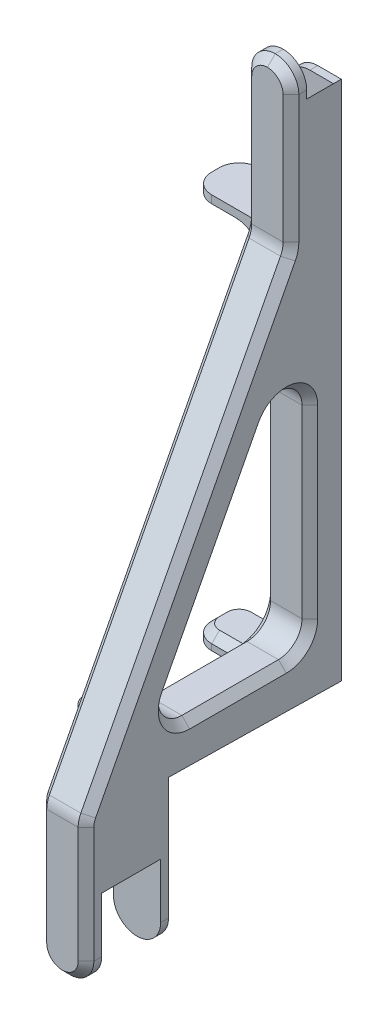
from build123d import *

# Parameters (mm, degrees)
BOSS_EXTRUDE1_DEPTH = 7.62
FILLET1_R           = 7.62
SKETCH2_W           = 8.636
SKETCH2_H           = 40.64
BOSS_EXTRUDE2_DEPTH = 2.54
SKETCH3_W           = 20.32
SKETCH3_H           = 3.81
SKETCH3_H_2         = 5.08
BOSS_EXTRUDE3_DEPTH = 15.24
SKETCH6_W           = 20.32
SKETCH6_H           = 15.24
BOSS_EXTRUDE5_DEPTH = 3.81
FILLET2_R           = 6.35
BOSS_EXTRUDE4_DEPTH = 50.8
CUT_EXTRUDE1_DEPTH  = 50.8
CHAMFER1_SIZE       = 2.54


# Some blends are built 0.0001 mm under size
with BuildPart() as part:
    # Sketch1 → Boss-Extrude1 (new, symmetric)
    with BuildSketch(Plane(origin=(0, 0, 0), x_dir=(0, 0, -1), z_dir=(1, 0, 0))):
        Polygon((-5.08, -40.64), (-13.716, -40.64), (-13.716, 10.16), (-18.796, 10.16), (-18.796, -40.64), (-85.09, -167.64), (-85.09, -214.63), (-80.01, -214.63), (-80.01, -189.23), (-60.96, -189.23), (-60.96, -214.63), (-55.88, -214.63), (-55.88, -167.64), (0, -167.64), (0, 0), (-5.08, 0), align=None)
        Polygon((-64.134437068, -154.94), (-12.7, -56.406595656), (-12.7, -154.94), align=None, mode=Mode.SUBTRACT)
    extrude(amount=BOSS_EXTRUDE1_DEPTH, both=True)

    # Fillet1
    fillet1_edges = [part.edges().sort_by_distance(p)[0] for p in [
        (0, -167.64, 85.09),
        (0, -56.406595656, 12.7),
        (0, -154.94, 12.7),
        (0, -40.64, 18.796),
        (0, -154.94, 64.134437068),
        (-7.62, 0, 2.54),
        (-7.62, 10.16, 16.256),
        (7.62, 10.16, 16.256),
        (-7.62, -214.63, 58.42),
        (7.62, -214.63, 58.42),
        (7.62, -214.63, 82.55),
        (-7.62, -214.63, 82.55),
    ]]
    fillet(fillet1_edges, radius=FILLET1_R - 0.0001)  # a hair under: the kernel refuses the full size

    # Sketch2 → Boss-Extrude2 (add)
    with BuildSketch(Plane(origin=(7.62, 0, 0), x_dir=(0, 0, -1), z_dir=(1, 0, 0))):
        with Locations((-9.398, -20.32)):
            Rectangle(SKETCH2_W, SKETCH2_H)
    extrude(amount=-BOSS_EXTRUDE2_DEPTH)

    # Sketch3 → Boss-Extrude3 (add)
    with BuildSketch(Plane(origin=(0, 0, 0), x_dir=(-1, 0, 0), z_dir=(0, 0, -1))):
        with Locations((17.78, -165.735)):
            Rectangle(SKETCH3_W, SKETCH3_H)
        with Locations((17.78, -43.18)):
            Rectangle(SKETCH3_W, SKETCH3_H_2)
    extrude(amount=-BOSS_EXTRUDE3_DEPTH)

    # Sketch6 → Boss-Extrude5 (add)
    with BuildSketch(Plane(origin=(0, -167.64, 0), x_dir=(-1, 0, 0), z_dir=(0, -1, 0))):
        with Locations((17.78, -48.26)):
            Rectangle(SKETCH6_W, SKETCH6_H)
    extrude(amount=-BOSS_EXTRUDE5_DEPTH)

    # Fillet2
    fillet2_edges = [part.edges().sort_by_distance(p)[0] for p in [
        (-7.62, -163.83, 7.62),
        (-27.94, -165.735, 15.24),
        (-27.94, -165.735, 0),
        (-7.62, -45.72, 7.62),
        (-27.94, -43.18, 15.24),
        (-27.94, -43.18, 0),
        (-27.94, -165.735, 55.88),
        (-27.94, -165.735, 40.64),
        (-7.62, -163.83, 48.26),
    ]]
    fillet(fillet2_edges, radius=FILLET2_R)

    # Sketch4 → Boss-Extrude4 (add)
    with BuildSketch(Plane(origin=(7.62, 0, 0), x_dir=(0, 0, -1), z_dir=(1, 0, 0))):
        Polygon((-55.88, -167.64), (0, -168.615389028), (0, -167.64), align=None)
    extrude(amount=-BOSS_EXTRUDE4_DEPTH)

    # Sketch5 → Cut-Extrude1 (cut)
    with BuildSketch(Plane(origin=(0, -167.64, 0), x_dir=(1, 0, 0), z_dir=(0, 1, 0))):
        with BuildLine():
            Line((-7.62, -40.64), (-7.62, -15.24))
            Line((-7.62, -15.24), (-21.59, -15.24))
            ThreePointArc((-21.59, -15.24), (-26.080128061, -13.380128061), (-27.94, -8.89))
            Line((-27.94, -8.89), (-27.94, -6.35))
            ThreePointArc((-27.94, -6.35), (-26.080128061, -1.859871939), (-21.59, 0))
            Line((-21.59, 0), (-43.18, 0))
            Line((-43.18, 0), (-43.18, -55.88))
            Line((-43.18, -55.88), (-21.59, -55.88))
            ThreePointArc((-21.59, -55.88), (-26.080128061, -54.020128061), (-27.94, -49.53))
            Line((-27.94, -49.53), (-27.94, -46.99))
            ThreePointArc((-27.94, -46.99), (-26.080128061, -42.499871939), (-21.59, -40.64))
            Line((-21.59, -40.64), (-7.62, -40.64))
        make_face()
    extrude(amount=-CUT_EXTRUDE1_DEPTH, mode=Mode.SUBTRACT)

    # Chamfer1
    # the kernel refuses this chamfer: 2.54 mm, written as the material it takes off along each edge
    with BuildSketch(Plane(origin=(-13.97, -157.48, 15.24), x_dir=(0.5156018398614169, 0.8568283041143783, 0), z_dir=(-0.8568283041143783, 0.5156018398614169, 0))) as chamfer1_piece_1_section:
        Polygon((6.35, CHAMFER1_SIZE), (6.35 + CHAMFER1_SIZE, 0), (6.35, 0), align=None)
    chamfer1_piece_1 = revolve(axis=Axis((-13.97, -157.48, 15.24), (0, 0, -1)), revolution_arc=148.962308712, mode=Mode.PRIVATE)
    chamfer1_piece_1 = split(chamfer1_piece_1, bisect_by=Plane(origin=(-7.62, -162.229769577, 14.262585921), z_dir=(-1, 0, 0)), keep=Keep.TOP, mode=Mode.PRIVATE)
    add(chamfer1_piece_1, mode=Mode.SUBTRACT)
    with BuildSketch(Plane(origin=(-21.59, -163.83, 15.24), x_dir=(0, 0.027495876610589984, -0.9996219169112966), z_dir=(1, 0, 0)), Plane(origin=(-21.59, -45.72, 0), x_dir=(0, -0.027495876610587288, 0.9996219169112968), z_dir=(1, 0, 0)), Plane(origin=(-21.59, -163.83, 55.88), x_dir=(0, 0.027495876610589984, -0.9996219169112966), z_dir=(1, 0, 0)), Plane(origin=(-13.97, -163.83, 40.64), x_dir=(0, 0.027495876610589984, 0.9996219169112966), z_dir=(-1, 0, 0))) as chamfer1_piece_2:
        Polygon((CHAMFER1_SIZE * 0.999621916911, -CHAMFER1_SIZE * 0.0274958766106), (-CHAMFER1_SIZE * 0.0274958766106, -CHAMFER1_SIZE * 0.999621916911), (0, 0), align=None)
    extrude(amount=7.62, mode=Mode.SUBTRACT)
    with BuildSketch(Plane(origin=(-21.59, -163.83, 8.89), x_dir=(-1, 0, 0), z_dir=(0, 0, -1))) as chamfer1_piece_3:
        Polygon((6.35 - CHAMFER1_SIZE, 0), (6.35, -CHAMFER1_SIZE), (6.35, 0), align=None)
    revolve(axis=Axis((-21.59, -163.83, 8.89), (0, 1, 0)), revolution_arc=90, mode=Mode.SUBTRACT)
    with BuildSketch(Plane(origin=(-21.59, -163.83, 6.35), x_dir=(0, 0, -1), z_dir=(1, 0, 0))) as chamfer1_piece_4:
        Polygon((6.35 - CHAMFER1_SIZE, 0), (6.35, -CHAMFER1_SIZE), (6.35, 0), align=None)
    revolve(axis=Axis((-21.59, -163.83, 6.35), (0, 1, 0)), revolution_arc=90, mode=Mode.SUBTRACT)
    with BuildSketch(Plane(origin=(-21.59, -163.83, 0), x_dir=(0, 0.027495876610590005, 0.9996219169112966), z_dir=(1, 0, 0)), Plane(origin=(-21.59, -45.72, 15.24), x_dir=(0, -0.027495876610587267, -0.9996219169112966), z_dir=(1, 0, 0))) as chamfer1_piece_5:
        Polygon((CHAMFER1_SIZE * 0.999621916911, CHAMFER1_SIZE * 0.0274958766106), (-CHAMFER1_SIZE * 0.0274958766106, CHAMFER1_SIZE * 0.999621916911), (0, 0), align=None)
    extrude(amount=7.62, mode=Mode.SUBTRACT)
    with BuildSketch(Plane(origin=(14.152074789, 0, 0), x_dir=(0, 0.027495876610586334, 0.9996219169112968), z_dir=(-1, 0, 0))) as chamfer1_piece_6:
        Polygon((CHAMFER1_SIZE * 0.999621916911, -CHAMFER1_SIZE * 0.0274958766106), (-CHAMFER1_SIZE * 0.0274958766106, -CHAMFER1_SIZE * 0.999621916911), (0, 0), align=None)
    extrude(amount=14.152174789, mode=Mode.SUBTRACT)
    with BuildSketch(Plane(origin=(-13.97, -157.48, 0), x_dir=(1, 0, 0), z_dir=(0, 1, 0))) as chamfer1_piece_7:
        Polygon((6.35, -CHAMFER1_SIZE), (6.35 + CHAMFER1_SIZE, 0), (6.35, 0), align=None)
    revolve(axis=Axis((-13.97, -157.48, 0), (0, 0, -1)), revolution_arc=90, mode=Mode.SUBTRACT)
    with BuildSketch(Plane(origin=(-0.0001, -7.6199, 0), x_dir=(0, 1, 0), z_dir=(1, 0, 0))) as chamfer1_piece_8:
        Polygon((7.6199, CHAMFER1_SIZE), (7.6199 - CHAMFER1_SIZE, 0), (7.6199, 0), align=None)
    revolve(axis=Axis((-0.0001, -7.6199, 0), (0, 0, 1)), revolution_arc=90, mode=Mode.SUBTRACT)
    with BuildSketch(Plane(origin=(-7.62, -157.48, 0), x_dir=(-0.027495876610586275, 0, 0.9996219169112968), z_dir=(0, 1, 0))) as chamfer1_piece_9:
        Polygon((CHAMFER1_SIZE * 0.999621916911, CHAMFER1_SIZE * 0.0274958766106), (-CHAMFER1_SIZE * 0.0274958766106, CHAMFER1_SIZE * 0.999621916911), (0, 0), align=None)
    extrude(amount=105.41, mode=Mode.SUBTRACT)
    with BuildSketch(Plane(origin=(-7.62, -40.64, 0), x_dir=(-0.027495876610586275, 0, 0.9996219169112968), z_dir=(0, 1, 0))) as chamfer1_piece_10:
        Polygon((CHAMFER1_SIZE * 0.999621916911, CHAMFER1_SIZE * 0.0274958766106), (-CHAMFER1_SIZE * 0.0274958766106, CHAMFER1_SIZE * 0.999621916911), (0, 0), align=None)
    extrude(amount=33.0201, mode=Mode.SUBTRACT)
    with BuildSketch(Plane(origin=(7.62, 6.532074789, 0), x_dir=(0.027495876610586275, 0, 0.9996219169112968), z_dir=(0, -1, 0))) as chamfer1_piece_11:
        Polygon((CHAMFER1_SIZE * 0.999621916911, CHAMFER1_SIZE * 0.0274958766106), (-CHAMFER1_SIZE * 0.0274958766106, CHAMFER1_SIZE * 0.999621916911), (0, 0), align=None)
    extrude(amount=181.679538607, mode=Mode.SUBTRACT)
    with BuildSketch(Plane(origin=(7.62, -169.509128266, 85.09), x_dir=(0.02749587661058625, 0, -0.9996219169112968), z_dir=(0, -1, 0))) as chamfer1_piece_12:
        Polygon((CHAMFER1_SIZE * 0.999621916911, -CHAMFER1_SIZE * 0.0274958766106), (-CHAMFER1_SIZE * 0.0274958766106, -CHAMFER1_SIZE * 0.999621916911), (0, 0), align=None)
    extrude(amount=37.500971734, mode=Mode.SUBTRACT)
    with BuildSketch(Plane(origin=(7.62, -169.509128266, 77.4701), x_dir=(0, 0, 1), z_dir=(0, -1, 0))) as chamfer1_piece_13:
        Polygon((7.6199 - CHAMFER1_SIZE, 0), (7.6199, CHAMFER1_SIZE), (7.6199, 0), align=None)
    revolve(axis=Axis((7.62, -169.509128266, 77.4701), (-1, 0, 0)), revolution_arc=27.564558934, mode=Mode.SUBTRACT)
    with BuildSketch(Plane(origin=(7.62, -42.296963493, 19.660934944), x_dir=(0.027495876610586296, -0.46257281641520054, -0.8861548207187752), z_dir=(0, -0.8864899875913883, 0.4627477735227046))) as chamfer1_piece_14:
        Polygon((CHAMFER1_SIZE * 0.999621916911, -CHAMFER1_SIZE * 0.0274958766106), (-CHAMFER1_SIZE * 0.0274958766106, -CHAMFER1_SIZE * 0.999621916911), (0, 0), align=None)
    extrude(amount=139.52337279, mode=Mode.SUBTRACT)
    with BuildSketch(Plane(origin=(7.62, -38.770871734, 26.4159), x_dir=(0, -0.4627477735227039, -0.8864899875913886), z_dir=(0, -0.8864899875913886, 0.4627477735227039))) as chamfer1_piece_15:
        Polygon((7.6199 + CHAMFER1_SIZE, 0), (7.6199, -CHAMFER1_SIZE), (7.6199, 0), align=None)
    revolve(axis=Axis((7.62, -38.770871734, 26.4159), (1, 0, 0)), revolution_arc=27.564558934, mode=Mode.SUBTRACT)
    with BuildSketch(Plane(origin=(7.62, 2.5401, 18.796), x_dir=(0.02749587661058629, 0, -0.9996219169112968), z_dir=(0, -1, 0))) as chamfer1_piece_16:
        Polygon((CHAMFER1_SIZE * 0.999621916911, -CHAMFER1_SIZE * 0.0274958766106), (-CHAMFER1_SIZE * 0.0274958766106, -CHAMFER1_SIZE * 0.999621916911), (0, 0), align=None)
    extrude(amount=41.310971734, mode=Mode.SUBTRACT)
    with BuildSketch(Plane(origin=(0.0001, 2.5401, 18.796), x_dir=(0, 1, 0), z_dir=(-1, 0, 0))) as chamfer1_piece_17:
        Polygon((7.6199, CHAMFER1_SIZE), (7.6199 - CHAMFER1_SIZE, 0), (7.6199, 0), align=None)
    revolve(axis=Axis((0.0001, 2.5401, 18.796), (0, 0, -1)), revolution_arc=90, mode=Mode.SUBTRACT)
    with BuildSketch(Plane(origin=(-0.0001, 2.5401, 18.796), x_dir=(0, 1, 0), z_dir=(1, 0, 0))) as chamfer1_piece_18:
        Polygon((7.6199 - CHAMFER1_SIZE, 0), (7.6199, -CHAMFER1_SIZE), (7.6199, 0), align=None)
    revolve(axis=Axis((-0.0001, 2.5401, 18.796), (0, 0, 1)), revolution_arc=90, mode=Mode.SUBTRACT)
    with BuildSketch(Plane(origin=(-7.62, 2.5401, 18.796), x_dir=(-0.02749587661058629, 0, -0.9996219169112968), z_dir=(0, -1, 0))) as chamfer1_piece_19:
        Polygon((CHAMFER1_SIZE * 0.999621916911, CHAMFER1_SIZE * 0.0274958766106), (-CHAMFER1_SIZE * 0.0274958766106, CHAMFER1_SIZE * 0.999621916911), (0, 0), align=None)
    extrude(amount=41.310971734, mode=Mode.SUBTRACT)
    with BuildSketch(Plane(origin=(-7.62, -169.509128266, 85.09), x_dir=(-0.02749587661058625, 0, -0.9996219169112968), z_dir=(0, -1, 0))) as chamfer1_piece_20:
        Polygon((CHAMFER1_SIZE * 0.999621916911, CHAMFER1_SIZE * 0.0274958766106), (-CHAMFER1_SIZE * 0.0274958766106, CHAMFER1_SIZE * 0.999621916911), (0, 0), align=None)
    extrude(amount=37.500971734, mode=Mode.SUBTRACT)
    with BuildSketch(Plane(origin=(-7.62, -38.770871734, 26.4159), x_dir=(0, -0.4627477735227039, -0.8864899875913886), z_dir=(0, -0.8864899875913886, 0.4627477735227039))) as chamfer1_piece_21:
        Polygon((7.6199 + CHAMFER1_SIZE, 0), (7.6199, CHAMFER1_SIZE), (7.6199, 0), align=None)
    revolve(axis=Axis((-7.62, -38.770871734, 26.4159), (1, 0, 0)), revolution_arc=27.564558934, mode=Mode.SUBTRACT)
    with BuildSketch(Plane(origin=(-7.62, -169.509128266, 77.4701), x_dir=(0, 0, 1), z_dir=(0, -1, 0))) as chamfer1_piece_22:
        Polygon((7.6199 - CHAMFER1_SIZE, 0), (7.6199, -CHAMFER1_SIZE), (7.6199, 0), align=None)
    revolve(axis=Axis((-7.62, -169.509128266, 77.4701), (-1, 0, 0)), revolution_arc=27.564558934, mode=Mode.SUBTRACT)
    with BuildSketch(Plane(origin=(-7.62, -42.296963493, 19.660934944), x_dir=(-0.027495876610586296, -0.46257281641520054, -0.8861548207187752), z_dir=(0, -0.8864899875913883, 0.4627477735227046))) as chamfer1_piece_23:
        Polygon((CHAMFER1_SIZE * 0.999621916911, CHAMFER1_SIZE * 0.0274958766106), (-CHAMFER1_SIZE * 0.0274958766106, CHAMFER1_SIZE * 0.999621916911), (0, 0), align=None)
    extrude(amount=139.52337279, mode=Mode.SUBTRACT)
    with BuildSketch(Plane(origin=(7.62, -87.470743079, 20.3199), x_dir=(0, 0, -1), z_dir=(0, -1, 0))) as chamfer1_piece_24:
        Polygon((7.6199 + CHAMFER1_SIZE, 0), (7.6199, -CHAMFER1_SIZE), (7.6199, 0), align=None)
    revolve(axis=Axis((7.62, -87.470743079, 20.3199), (1, 0, 0)), revolution_arc=152.435441066, mode=Mode.SUBTRACT)
    with BuildSketch(Plane(origin=(7.62, -143.794008241, 58.316229369), x_dir=(0.027495876610586226, 0.46257281641520065, 0.886154820718775), z_dir=(0, 0.8864899875913882, -0.4627477735227047))) as chamfer1_piece_25:
        Polygon((CHAMFER1_SIZE * 0.999621916911, -CHAMFER1_SIZE * 0.0274958766106), (-CHAMFER1_SIZE * 0.0274958766106, -CHAMFER1_SIZE * 0.999621916911), (0, 0), align=None)
    extrude(amount=67.512727452, mode=Mode.SUBTRACT)
    with BuildSketch(Plane(origin=(7.62, -87.470743079, 12.7), x_dir=(0.027495876610586268, 0, -0.9996219169112968), z_dir=(0, -1, 0))) as chamfer1_piece_26:
        Polygon((CHAMFER1_SIZE * 0.999621916911, -CHAMFER1_SIZE * 0.0274958766106), (-CHAMFER1_SIZE * 0.0274958766106, -CHAMFER1_SIZE * 0.999621916911), (0, 0), align=None)
    extrude(amount=59.849356921, mode=Mode.SUBTRACT)
    with BuildSketch(Plane(origin=(7.62, -147.3201, 51.561264313), x_dir=(0, -1, 0), z_dir=(0, 0, -1))) as chamfer1_piece_27:
        Polygon((7.6199, CHAMFER1_SIZE), (7.6199 + CHAMFER1_SIZE, 0), (7.6199, 0), align=None)
    revolve(axis=Axis((7.62, -147.3201, 51.561264313), (-1, 0, 0)), revolution_arc=117.564558934, mode=Mode.SUBTRACT)
    with BuildSketch(Plane(origin=(7.62, -147.3201, 20.3199), x_dir=(0, -1, 0), z_dir=(0, 0, 1))) as chamfer1_piece_28:
        Polygon((7.6199 + CHAMFER1_SIZE, 0), (7.6199, -CHAMFER1_SIZE), (7.6199, 0), align=None)
    revolve(axis=Axis((7.62, -147.3201, 20.3199), (1, 0, 0)), revolution_arc=90, mode=Mode.SUBTRACT)
    with BuildSketch(Plane(origin=(7.62, -154.94, 20.3199), x_dir=(0.02749587661058625, -0.9996219169112968, 0), z_dir=(0, 0, 1))) as chamfer1_piece_29:
        Polygon((CHAMFER1_SIZE * 0.999621916911, -CHAMFER1_SIZE * 0.0274958766106), (-CHAMFER1_SIZE * 0.0274958766106, -CHAMFER1_SIZE * 0.999621916911), (0, 0), align=None)
    extrude(amount=31.241364313, mode=Mode.SUBTRACT)
    with BuildSketch(Plane(origin=(-7.62, -147.3201, 20.3199), x_dir=(0, -1, 0), z_dir=(0, 0, 1))) as chamfer1_piece_30:
        Polygon((7.6199 + CHAMFER1_SIZE, 0), (7.6199, CHAMFER1_SIZE), (7.6199, 0), align=None)
    revolve(axis=Axis((-7.62, -147.3201, 20.3199), (1, 0, 0)), revolution_arc=90, mode=Mode.SUBTRACT)
    with BuildSketch(Plane(origin=(-7.62, -87.470743079, 12.7), x_dir=(-0.027495876610586268, 0, -0.9996219169112968), z_dir=(0, -1, 0))) as chamfer1_piece_31:
        Polygon((CHAMFER1_SIZE * 0.999621916911, CHAMFER1_SIZE * 0.0274958766106), (-CHAMFER1_SIZE * 0.0274958766106, CHAMFER1_SIZE * 0.999621916911), (0, 0), align=None)
    extrude(amount=59.849356921, mode=Mode.SUBTRACT)
    with BuildSketch(Plane(origin=(-7.62, -154.94, 20.3199), x_dir=(-0.02749587661058625, -0.9996219169112968, 0), z_dir=(0, 0, 1))) as chamfer1_piece_32:
        Polygon((CHAMFER1_SIZE * 0.999621916911, CHAMFER1_SIZE * 0.0274958766106), (-CHAMFER1_SIZE * 0.0274958766106, CHAMFER1_SIZE * 0.999621916911), (0, 0), align=None)
    extrude(amount=31.241364313, mode=Mode.SUBTRACT)
    with BuildSketch(Plane(origin=(-7.62, -87.470743079, 20.3199), x_dir=(0, 0, -1), z_dir=(0, -1, 0))) as chamfer1_piece_33:
        Polygon((7.6199 + CHAMFER1_SIZE, 0), (7.6199, CHAMFER1_SIZE), (7.6199, 0), align=None)
    revolve(axis=Axis((-7.62, -87.470743079, 20.3199), (1, 0, 0)), revolution_arc=152.435441066, mode=Mode.SUBTRACT)
    with BuildSketch(Plane(origin=(-7.62, -147.3201, 51.561264313), x_dir=(0, -1, 0), z_dir=(0, 0, -1))) as chamfer1_piece_34:
        Polygon((7.6199 + CHAMFER1_SIZE, 0), (7.6199, -CHAMFER1_SIZE), (7.6199, 0), align=None)
    revolve(axis=Axis((-7.62, -147.3201, 51.561264313), (-1, 0, 0)), revolution_arc=117.564558934, mode=Mode.SUBTRACT)
    with BuildSketch(Plane(origin=(-7.62, -143.794008241, 58.316229369), x_dir=(-0.027495876610586226, 0.46257281641520065, 0.886154820718775), z_dir=(0, 0.8864899875913882, -0.4627477735227047))) as chamfer1_piece_35:
        Polygon((CHAMFER1_SIZE * 0.999621916911, CHAMFER1_SIZE * 0.0274958766106), (-CHAMFER1_SIZE * 0.0274958766106, CHAMFER1_SIZE * 0.999621916911), (0, 0), align=None)
    extrude(amount=67.512727452, mode=Mode.SUBTRACT)
    with BuildSketch(Plane(origin=(5.08, 0, 5.08), x_dir=(0.9996219169112968, 0.02749587661058637, 0), z_dir=(0, 0, 1))) as chamfer1_piece_36:
        Polygon((CHAMFER1_SIZE * 0.999621916911, -CHAMFER1_SIZE * 0.0274958766106), (-CHAMFER1_SIZE * 0.0274958766106, -CHAMFER1_SIZE * 0.999621916911), (0, 0), align=None)
    extrude(amount=8.636, mode=Mode.SUBTRACT)
    with BuildSketch(Plane(origin=(-13.97, -52.07, 15.24), x_dir=(0.5156018398614204, -0.8568283041143764, 0), z_dir=(-0.8568283041143764, -0.5156018398614204, 0))) as chamfer1_piece_37_section:
        Polygon((6.35, -CHAMFER1_SIZE), (6.35 + CHAMFER1_SIZE, 0), (6.35, 0), align=None)
    chamfer1_piece_37 = revolve(axis=Axis((-13.97, -52.07, 15.24), (0, 0, 1)), revolution_arc=148.962308712, mode=Mode.PRIVATE)
    chamfer1_piece_37 = split(chamfer1_piece_37, bisect_by=Plane(origin=(-7.62, -47.320230423, 14.262585921), z_dir=(-1, 0, 0)), keep=Keep.TOP, mode=Mode.PRIVATE)
    add(chamfer1_piece_37, mode=Mode.SUBTRACT)
    with BuildSketch(Plane(origin=(-21.59, -45.72, 8.89), x_dir=(-1, 0, 0), z_dir=(0, 0, -1))) as chamfer1_piece_38:
        Polygon((6.35 - CHAMFER1_SIZE, 0), (6.35, CHAMFER1_SIZE), (6.35, 0), align=None)
    revolve(axis=Axis((-21.59, -45.72, 8.89), (0, 1, 0)), revolution_arc=90, mode=Mode.SUBTRACT)
    with BuildSketch(Plane(origin=(-21.59, -45.72, 6.35), x_dir=(0, 0, -1), z_dir=(1, 0, 0))) as chamfer1_piece_39:
        Polygon((6.35 - CHAMFER1_SIZE, 0), (6.35, CHAMFER1_SIZE), (6.35, 0), align=None)
    revolve(axis=Axis((-21.59, -45.72, 6.35), (0, 1, 0)), revolution_arc=90, mode=Mode.SUBTRACT)
    with BuildSketch(Plane(origin=(-13.97, -52.07, 0), x_dir=(1, 0, 0), z_dir=(0, -1, 0))) as chamfer1_piece_40:
        Polygon((6.35, CHAMFER1_SIZE), (6.35 + CHAMFER1_SIZE, 0), (6.35, 0), align=None)
    revolve(axis=Axis((-13.97, -52.07, 0), (0, 0, 1)), revolution_arc=90, mode=Mode.SUBTRACT)
    with BuildSketch(Plane(origin=(0.0001, -207.0101, 85.09), x_dir=(0, -1, 0), z_dir=(-1, 0, 0))) as chamfer1_piece_41:
        Polygon((7.6199, -CHAMFER1_SIZE), (7.6199 - CHAMFER1_SIZE, 0), (7.6199, 0), align=None)
    revolve(axis=Axis((0.0001, -207.0101, 85.09), (0, 0, 1)), revolution_arc=90, mode=Mode.SUBTRACT)
    with BuildSketch(Plane(origin=(-0.0001, -207.0101, 85.09), x_dir=(0, -1, 0), z_dir=(1, 0, 0))) as chamfer1_piece_42:
        Polygon((7.6199, CHAMFER1_SIZE), (7.6199 - CHAMFER1_SIZE, 0), (7.6199, 0), align=None)
    revolve(axis=Axis((-0.0001, -207.0101, 85.09), (0, 0, -1)), revolution_arc=90, mode=Mode.SUBTRACT)
    with BuildSketch(Plane(origin=(-27.94, -163.83, 6.35), x_dir=(0.9996219169112966, 0.027495876610590022, 0), z_dir=(0, 0, 1)), Plane(origin=(-27.94, -163.83, 46.99), x_dir=(0.9996219169112966, 0.027495876610590022, 0), z_dir=(0, 0, 1))) as chamfer1_piece_43:
        Polygon((CHAMFER1_SIZE * 0.999621916911, -CHAMFER1_SIZE * 0.0274958766106), (-CHAMFER1_SIZE * 0.0274958766106, -CHAMFER1_SIZE * 0.999621916911), (0, 0), align=None)
    extrude(amount=2.54, mode=Mode.SUBTRACT)
    with BuildSketch(Plane(origin=(-27.94, -45.72, 6.35), x_dir=(0.9996219169112966, -0.027495876610587302, 0), z_dir=(0, 0, 1))) as chamfer1_piece_44:
        Polygon((CHAMFER1_SIZE * 0.999621916911, CHAMFER1_SIZE * 0.0274958766106), (-CHAMFER1_SIZE * 0.0274958766106, CHAMFER1_SIZE * 0.999621916911), (0, 0), align=None)
    extrude(amount=2.54, mode=Mode.SUBTRACT)
    with BuildSketch(Plane(origin=(-13.97, -157.48, 55.88), x_dir=(0.5156018398614173, 0.8568283041143783, 0), z_dir=(-0.8568283041143783, 0.5156018398614173, 0))) as chamfer1_piece_45_section:
        Polygon((6.35, CHAMFER1_SIZE), (6.35 + CHAMFER1_SIZE, 0), (6.35, 0), align=None)
    chamfer1_piece_45 = revolve(axis=Axis((-13.97, -157.48, 55.88), (0, 0, -1)), revolution_arc=148.962308712, mode=Mode.PRIVATE)
    chamfer1_piece_45 = split(chamfer1_piece_45, bisect_by=Plane(origin=(-7.62, -162.229769577, 54.902585921), z_dir=(-1, 0, 0)), keep=Keep.TOP, mode=Mode.PRIVATE)
    add(chamfer1_piece_45, mode=Mode.SUBTRACT)
    with BuildSketch(Plane(origin=(-21.59, -163.83, 49.53), x_dir=(0, 0, 1), z_dir=(1, 0, 0))) as chamfer1_piece_46:
        Polygon((6.35, CHAMFER1_SIZE), (6.35 - CHAMFER1_SIZE, 0), (6.35, 0), align=None)
    revolve(axis=Axis((-21.59, -163.83, 49.53), (0, -1, 0)), revolution_arc=90, mode=Mode.SUBTRACT)
    with BuildSketch(Plane(origin=(-21.59, -163.83, 46.99), x_dir=(0, 0, -1), z_dir=(1, 0, 0))) as chamfer1_piece_47:
        Polygon((6.35 - CHAMFER1_SIZE, 0), (6.35, -CHAMFER1_SIZE), (6.35, 0), align=None)
    revolve(axis=Axis((-21.59, -163.83, 46.99), (0, 1, 0)), revolution_arc=90, mode=Mode.SUBTRACT)
    with BuildSketch(Plane(origin=(-13.97, -157.48, 40.64), x_dir=(0.5156018398614173, 0.8568283041143783, 0), z_dir=(-0.8568283041143783, 0.5156018398614173, 0))) as chamfer1_piece_48_section:
        Polygon((6.35 + CHAMFER1_SIZE, 0), (6.35, -CHAMFER1_SIZE), (6.35, 0), align=None)
    chamfer1_piece_48 = revolve(axis=Axis((-13.97, -157.48, 40.64), (0, 0, -1)), revolution_arc=148.962308712, mode=Mode.PRIVATE)
    chamfer1_piece_48 = split(chamfer1_piece_48, bisect_by=Plane(origin=(-7.62, -162.229769577, 41.617414079), z_dir=(-1, 0, 0)), keep=Keep.TOP, mode=Mode.PRIVATE)
    add(chamfer1_piece_48, mode=Mode.SUBTRACT)
    with BuildSketch(Plane(origin=(7.62, -207.0101, 55.88), x_dir=(0.02749587661058625, 0, 0.9996219169112968), z_dir=(0, 1, 0))) as chamfer1_piece_49_section:
        Polygon((CHAMFER1_SIZE * 0.999621916911, -CHAMFER1_SIZE * 0.0274958766106), (-CHAMFER1_SIZE * 0.0274958766106, -CHAMFER1_SIZE * 0.999621916911), (0, 0), align=None)
    chamfer1_piece_49 = extrude(amount=45.902174789, mode=Mode.PRIVATE)
    chamfer1_piece_49 = split(chamfer1_piece_49, bisect_by=Plane(origin=(6.793690141, -167.630559471, 56.420847553), z_dir=(0, -0.9998476951563913, 0.017452406437283546)), keep=Keep.TOP, mode=Mode.PRIVATE)
    add(chamfer1_piece_49, mode=Mode.SUBTRACT)
    with BuildSketch(Plane(origin=(0.0001, -207.0101, 55.88), x_dir=(0, -1, 0), z_dir=(-1, 0, 0))) as chamfer1_piece_50:
        Polygon((7.6199, CHAMFER1_SIZE), (7.6199 - CHAMFER1_SIZE, 0), (7.6199, 0), align=None)
    revolve(axis=Axis((0.0001, -207.0101, 55.88), (0, 0, 1)), revolution_arc=90, mode=Mode.SUBTRACT)
    with BuildSketch(Plane(origin=(-0.0001, -207.0101, 55.88), x_dir=(0, -1, 0), z_dir=(1, 0, 0))) as chamfer1_piece_51:
        Polygon((7.6199 - CHAMFER1_SIZE, 0), (7.6199, -CHAMFER1_SIZE), (7.6199, 0), align=None)
    revolve(axis=Axis((-0.0001, -207.0101, 55.88), (0, 0, -1)), revolution_arc=90, mode=Mode.SUBTRACT)
    with BuildSketch(Plane(origin=(-7.62, -207.0101, 55.88), x_dir=(-0.02749587661058625, 0, 0.9996219169112968), z_dir=(0, 1, 0))) as chamfer1_piece_52_section:
        Polygon((CHAMFER1_SIZE * 0.999621916911, CHAMFER1_SIZE * 0.0274958766106), (-CHAMFER1_SIZE * 0.0274958766106, CHAMFER1_SIZE * 0.999621916911), (0, 0), align=None)
    chamfer1_piece_52 = extrude(amount=45.902174789, mode=Mode.PRIVATE)
    chamfer1_piece_52 = split(chamfer1_piece_52, bisect_by=Plane(origin=(-6.793690141, -167.630559471, 56.420847553), z_dir=(0, -0.9998476951563913, 0.017452406437283546)), keep=Keep.TOP, mode=Mode.PRIVATE)
    add(chamfer1_piece_52, mode=Mode.SUBTRACT)
    with BuildSketch(Plane(origin=(-0.0001, -214.63, 55.88), x_dir=(0, -0.027495876610589984, 0.9996219169112966), z_dir=(1, 0, 0)), Plane(origin=(-0.0001, 10.16, 18.796), x_dir=(0, 0.02749587661058663, -0.9996219169112968), z_dir=(1, 0, 0))) as chamfer1_piece_53:
        Polygon((CHAMFER1_SIZE * 0.999621916911, -CHAMFER1_SIZE * 0.0274958766106), (-CHAMFER1_SIZE * 0.0274958766106, -CHAMFER1_SIZE * 0.999621916911), (0, 0), align=None)
    extrude(amount=0.0002, mode=Mode.SUBTRACT)
    with BuildSketch(Plane(origin=(-0.0001, -214.63, 85.09), x_dir=(0, -0.027495876610589984, -0.9996219169112966), z_dir=(1, 0, 0))) as chamfer1_piece_54:
        Polygon((CHAMFER1_SIZE * 0.999621916911, CHAMFER1_SIZE * 0.0274958766106), (-CHAMFER1_SIZE * 0.0274958766106, CHAMFER1_SIZE * 0.999621916911), (0, 0), align=None)
    extrude(amount=0.0002, mode=Mode.SUBTRACT)


solid = part.part
